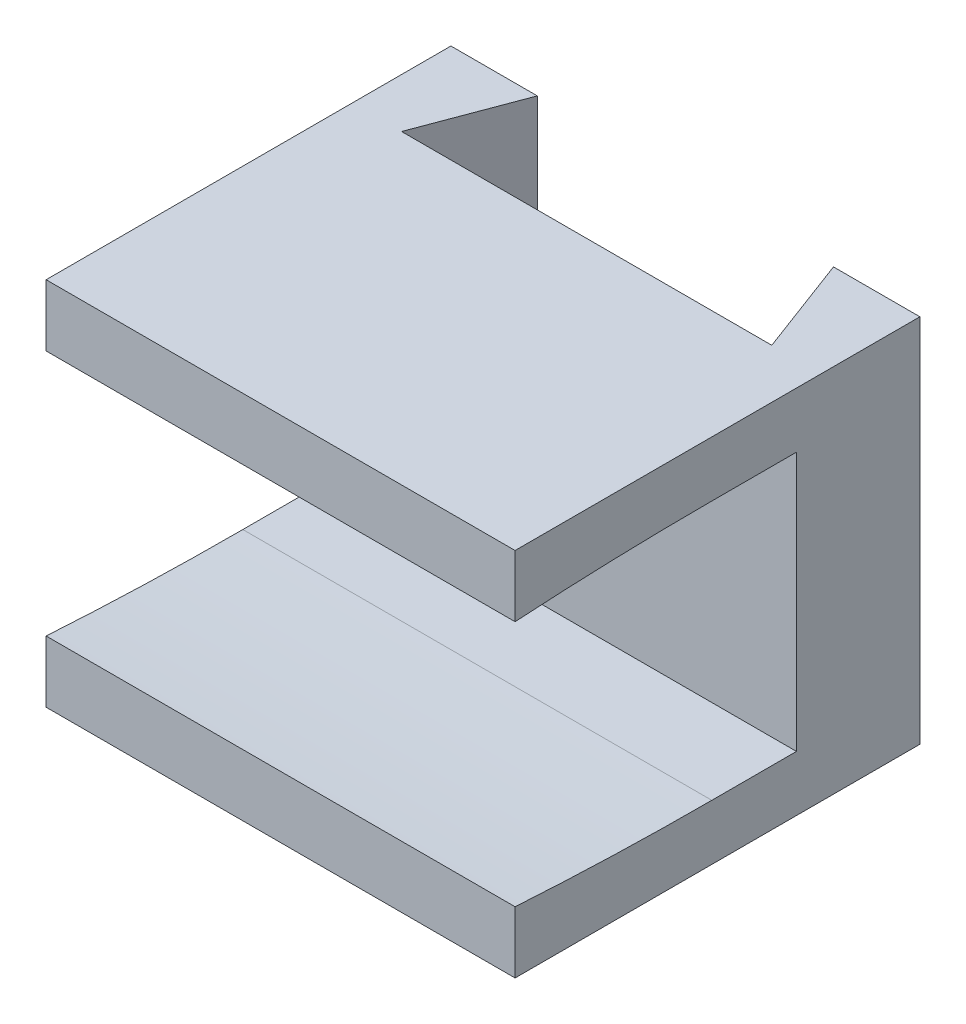
from build123d import *

# Parameters (mm, degrees)
BOSS_EXTRUDE1_DEPTH = 15
BOSS_EXTRUDE2_DEPTH = 19


with BuildPart() as part:
    # Sketch2 → Boss-Extrude1 (new body)
    with BuildSketch(Plane(origin=(0, 0, 0), x_dir=(1, 0, 0), z_dir=(0, 1, 0))):
        Polygon((0, 0), (15, 0), (13.5, 4), (15, 4), (17, 4), (17, -1), (-2, -1), (-2, 4), (0, 4), (1.5, 4), align=None)
    extrude(amount=BOSS_EXTRUDE1_DEPTH)

    # Sketch5 → Boss-Extrude2 (add)
    with BuildSketch(Plane(origin=(17, 0, 0), x_dir=(0, 0, -1), z_dir=(1, 0, 0))):
        with BuildLine():
            Line((-1, 2.25), (-4.43, 2.25))
            ThreePointArc((-4.43, 2.25), (-8.416959995, 2.312515366), (-12.4, 2.5))
            Line((-12.4, 2.5), (-12.4, 0))
            Line((-12.4, 0), (-1, 0))
            Line((-1, 0), (-1, 2.25))
        make_face()
        with BuildLine():
            Line((-1, 12.75), (-4.43, 12.75))
            ThreePointArc((-4.43, 12.75), (-8.416959995, 12.687484634), (-12.4, 12.5))
            Line((-12.4, 12.5), (-12.4, 15))
            Line((-12.4, 15), (-1, 15))
            Line((-1, 15), (-1, 12.75))
        make_face()
    extrude(amount=-BOSS_EXTRUDE2_DEPTH)


solid = part.part
